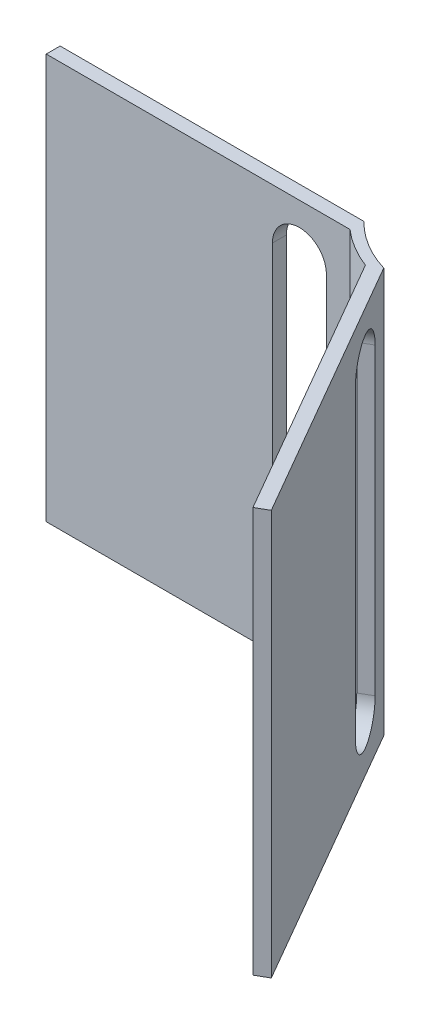
from build123d import *

# Parameters (mm, degrees)
BOSS_EXTRU_1_DEPTH      = 120
ENL_V_MAT_EXTRU_1_DEPTH = 188.009777727
ENL_V_MAT_EXTRU_2_DEPTH = 180.784310366


with BuildPart() as part:
    # Esquisse3 → Boss.-Extru.1 (new body)
    with BuildSketch(Plane(origin=(0, 0, 0), x_dir=(1, 0, 0), z_dir=(0, 1, 0))):
        with BuildLine():
            ThreePointArc((-10.103808925, -33.509894736), (-18.121448463, -29.943498553), (-25, -24.494897428))
            Line((-25, -24.494897428), (-115, -24.494897428))
            Line((-115, -24.494897428), (-115, -28.618176043))
            Line((-115, -28.618176043), (-25, -28.618176043))
            ThreePointArc((-25, -28.618176043), (-19.581111, -32.566548666), (-13.552631037, -35.50107311))
            Line((-13.552631037, -35.50107311), (31.963111135, -114.336651096))
            Line((31.963111135, -114.336651096), (35.411933246, -112.345472721))
            Line((35.411933246, -112.345472721), (-10.103808925, -33.509894736))
        make_face()
    extrude(amount=BOSS_EXTRU_1_DEPTH)

    # Esquisse4 → Enlèv. mat.-Extru.1 (cut, through all)
    with BuildSketch(Plane.XY.offset(28.618176043)):
        with BuildLine():
            Line((-48, 105), (-48, 15))
            ThreePointArc((-48, 15), (-40, 7), (-32, 15))
            Line((-32, 15), (-32, 105))
            ThreePointArc((-32, 105), (-40, 113), (-48, 105))
        make_face()
    extrude(amount=-ENL_V_MAT_EXTRU_1_DEPTH, mode=Mode.SUBTRACT)

    # Esquisse5 → Enlèv. mat.-Extru.2 (cut, through all)
    with BuildSketch(Plane(origin=(-25.536888865, 0, 14.743729661), x_dir=(0.4999999999999999, 0, 0.8660254037844386), z_dir=(-0.8660254037844387, 0, 0.49999999999999994))):
        with BuildLine():
            Line((46.968515657, 105), (46.968515657, 15))
            ThreePointArc((46.968515657, 15), (38.968515657, 7), (30.968515657, 15))
            Line((30.968515657, 15), (30.968515657, 105))
            ThreePointArc((30.968515657, 105), (38.968515657, 113), (46.968515657, 105))
        make_face()
    extrude(amount=-ENL_V_MAT_EXTRU_2_DEPTH, mode=Mode.SUBTRACT)


solid = part.part
